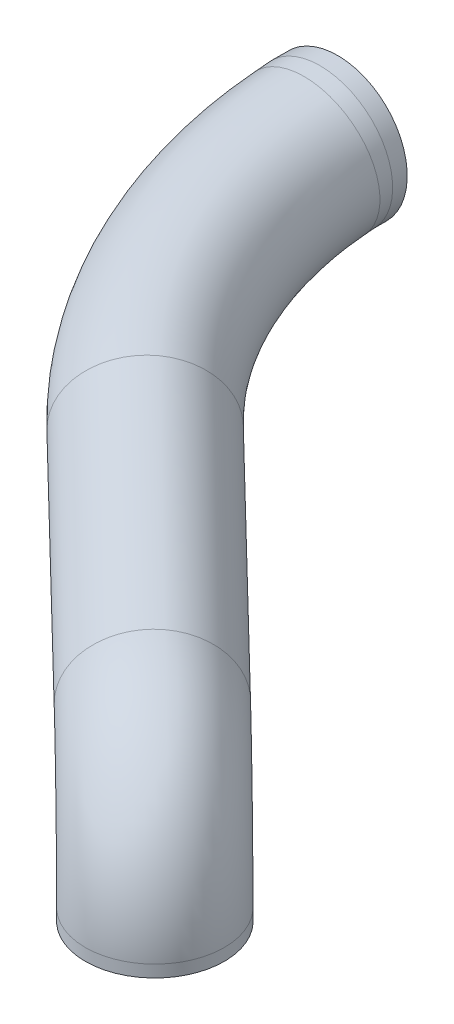
from build123d import *

# Parameters (mm, degrees)
SKETCH9_R   = 9.5
SKETCH9_R_2 = 7


with BuildPart() as part:
    # Sweep2: sweep along a curve in space
    with BuildLine() as sweep2_path:
        Line((-54.5, 26, -79.5), (-54.5, 26, -77.5))
        Line((-54.5, 26, -77.5), (-54.5, 25.845789916, -75.737370679))
        ThreePointArc((-37.896159721, 21.133689142, -36.571624653), (-50.178781873, 23.648627217, -54.447811544), (-54.5, 25.845789916, -75.737370679))
        Line((-9.544907707, 16.544892601, -9.211296991), (-37.896159721, 21.133689142, -36.571624653))
        ThreePointArc((-9.544907707, 16.544892601, -9.211296991), (-2.731974295, 11.619845216, -2.636487159), (0, 1.645601902, 0))
        Line((0, 0, 0), (0, 1.645601902, 0))
    # Sketch9 → Sweep2 (sweep)
    with BuildSketch(Plane(origin=(0, 0, 0), x_dir=(1, 0, 0), z_dir=(0, 1, 0))):
        Circle(SKETCH9_R)
        Circle(SKETCH9_R_2, mode=Mode.SUBTRACT)
    sweep(path=sweep2_path.line, transition=Transition.RIGHT)


solid = part.part
